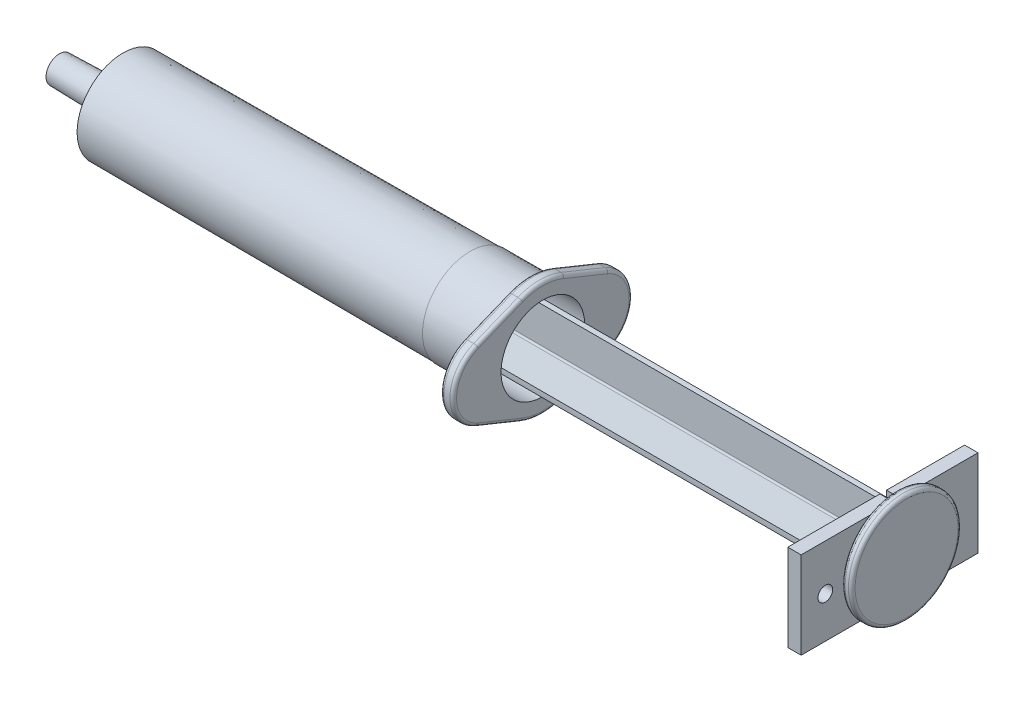
from build123d import *

# Parameters (mm, degrees)
BOSS_EXTRUDE1_DEPTH       = 1.9
FILLET1_R                 = 8.6
FILLET2_R                 = 0.25
FILLET3_R                 = 0.5
FILLET4_R                 = 1
BOSS_EXTRUDE2_START       = 53.880055185
BOSS_EXTRUDE2_2_DEPTH     = 71.319944815
BOSS_EXTRUDE2_START_2     = 123.2
BOSS_EXTRUDE2_3_OUTLINE_R = 1.098363789
BOSS_EXTRUDE2_3_DEPTH     = 2
BOSS_EXTRUDE2_START_3     = 52.05
BOSS_EXTRUDE2_4_DEPTH     = 4.040129852


with BuildPart() as part:
    # Sketch1 → Boss-Extrude1 (new body)
    with BuildSketch(Plane(origin=(72.3, 0, 0), x_dir=(0, 0, -1), z_dir=(1, 0, 0))):
        with BuildLine():
            Line((-9.834595004, -5.292759782), (0, -9.279892888))
            Line((0, -9.279892888), (9.834595004, -5.292759782))
            ThreePointArc((9.834595004, -5.292759782), (13.4, 0), (9.834595004, 5.292759782))
            Line((9.834595004, 5.292759782), (0, 9.279892888))
            Line((0, 9.279892888), (-9.834595004, 5.292759782))
            ThreePointArc((-9.834595004, 5.292759782), (-13.4, 0), (-9.834595004, -5.292759782))
        make_face()
    extrude(amount=-BOSS_EXTRUDE1_DEPTH)

    # Sketch2 → Revolve1 (revolve)
    with BuildSketch(Plane(origin=(0, 0, 0), x_dir=(-1, 0, 0), z_dir=(0, 0, -1)), mode=Mode.PRIVATE) as revolve1_sk:
        Polygon((-70.4, 7.131416054), (-70.4, 0), (0, 0), (0, 2), (-8.5, 2.2), (-9.5, 6.85), (-61.4, 7.031165912), (-61.4, 7.1), align=None)
    revolve(revolve1_sk.sketch.rotate(Axis((70.4, 0, 0), (-1, 0, 0)), 90), axis=Axis((70.4, 0, 0), (-1, 0, 0)))

    # Sketch3 → Hole1 (revolve, cut)
    with BuildSketch(Plane(origin=(72.3, 0, 0), x_dir=(0, 0, -1), z_dir=(0, 1, 0))):
        Polygon((0, 0), (0, 72.3), (1, 72.3), (1, 63.239774349), (6.25, 62.110742091), (6.25, 0), align=None)
    revolve(axis=Axis((78.430023899, 0, 0), (-1, 0, 0)), mode=Mode.SUBTRACT)

    # Fillet1
    fillet1_edges = [part.edges().sort_by_distance(p)[0] for p in [
        (71.35, 9.279892888, 0),
        (71.35, -9.279892888, 0),
    ]]
    fillet(fillet1_edges, radius=FILLET1_R)

    # Fillet2
    fillet2_edges = [part.edges().sort_by_distance(p)[0] for p in [
        (9.060225651, 0, 1),
    ]]
    fillet(fillet2_edges, radius=FILLET2_R)

    # Fillet3
    fillet3_edges = [part.edges().sort_by_distance(p)[0] for p in [
        (70.4, 0, -13.4),
        (70.4, 0, 7.131416054),
        (70.4, 6.631339679, -6.532876496),
        (72.3, -6.631339679, -6.532876496),
        (72.3, 6.631339679, 6.532876496),
        (72.3, 8.6, 0),
        (72.3, -8.6, 0),
        (70.4, -6.631339679, -6.532876496),
        (70.4, 6.631339679, 6.532876496),
        (70.4, 8.6, 0),
        (70.4, -8.6, 0),
        (70.4, 0, 13.4),
        (72.3, 6.631339679, -6.532876496),
        (72.3, 0, -13.4),
        (72.3, -6.631339679, 6.532876496),
        (72.3, 0, 13.4),
        (70.4, -6.631339679, 6.532876496),
    ]]
    fillet(fillet3_edges, radius=FILLET3_R)

    # Fillet4
    fillet4_edges = [part.edges().sort_by_distance(p)[0] for p in [
        (8.5, 0, 2.2),
    ]]
    fillet(fillet4_edges, radius=FILLET4_R)


with BuildPart() as body_2:
    # Boss-Extrude2: read off the stored shape, not the designer's step
    # Boss-Extrude2 outline → Boss-Extrude2 (revolve)
    with BuildSketch(Plane.YX):
        with BuildLine():
            ThreePointArc((7.7, 125.2), (8.053553391, 125.346446609), (8.2, 125.7))
            Line((8.2, 125.7), (8.2, 126.2))
            ThreePointArc((8.2, 126.2), (8.053553391, 126.553553391), (7.7, 126.7))
            Line((7.7, 126.7), (0, 126.7))
            Line((0, 126.7), (0, 125.2))
            Line((0, 125.2), (7.7, 125.2))
        make_face()
        with BuildLine():
            ThreePointArc((5.920861832, 51.089408107), (6.156875164, 51.226512359), (6.25, 51.483081323))
            Line((6.25, 51.483081323), (6.25, 52.05))
            Line((6.25, 52.05), (0, 52.05))
            Line((0, 52.05), (0, 50.45))
            add(Edge.make_bspline(
                [(5.920861832, 51.089408107), (2.983013586, 50.560590548), (0, 50.45)],
                knots=[1.392701781, 1.392701781, 1.392701781, 1.533739867, 1.533739867, 1.533739867], degree=2, weights=[1, 0.997514563, 1]))
        make_face()
    revolve(axis=Axis((0, 0, 0), (1, 0, 0)))

    # Boss-Extrude2 2 outline → Boss-Extrude2 2 (add)
    with BuildSketch(Plane.YZ.offset(BOSS_EXTRUDE2_START)):
        with BuildLine():
            ThreePointArc((-0.738087536, -0.492488713), (-0.565673942, -0.565673942), (-0.492488713, -0.738087536))
            Line((-0.492488713, -0.738087536), (-0.40023184, -6.023480263))
            ThreePointArc((-0.40023184, -6.023480263), (0, -6.036762377), (0.40023184, -6.023480263))
            Line((0.40023184, -6.023480263), (0.492488713, -0.738087536))
            ThreePointArc((0.492488713, -0.738087536), (0.565673942, -0.565673942), (0.738087536, -0.492488713))
            Line((0.738087536, -0.492488713), (6.023480263, -0.40023184))
            ThreePointArc((6.023480263, -0.40023184), (6.036762377, 0), (6.023480263, 0.40023184))
            Line((6.023480263, 0.40023184), (0.738087536, 0.492488713))
            ThreePointArc((0.738087536, 0.492488713), (0.565673942, 0.565673942), (0.492488713, 0.738087536))
            Line((0.492488713, 0.738087536), (0.40023184, 6.023480263))
            ThreePointArc((0.40023184, 6.023480263), (0, 6.036762377), (-0.40023184, 6.023480263))
            Line((-0.40023184, 6.023480263), (-0.492488713, 0.738087536))
            ThreePointArc((-0.492488713, 0.738087536), (-0.565673942, 0.565673942), (-0.738087536, 0.492488713))
            Line((-0.738087536, 0.492488713), (-6.023480263, 0.40023184))
            ThreePointArc((-6.023480263, 0.40023184), (-6.036762377, 0), (-6.023480263, -0.40023184))
            Line((-6.023480263, -0.40023184), (-0.738087536, -0.492488713))
        make_face()
    extrude(amount=BOSS_EXTRUDE2_2_DEPTH)

    # Boss-Extrude2 3 outline → Boss-Extrude2 3 (add)
    with BuildSketch(Plane.YZ.offset(BOSS_EXTRUDE2_START_2)):
        with BuildLine():
            ThreePointArc((-0.492488713, -0.738087536), (-0.565673942, -0.565673942), (-0.738087536, -0.492488713))
            Line((-0.738087536, -0.492488713), (-6.023480263, -0.40023184))
            ThreePointArc((-6.023480263, -0.40023184), (-6.036762377, 0), (-6.023480263, 0.40023184))
            Line((-6.023480263, 0.40023184), (-0.738087536, 0.492488713))
            ThreePointArc((-0.738087536, 0.492488713), (-0.565673942, 0.565673942), (-0.492488713, 0.738087536))
            Line((-0.492488713, 0.738087536), (-0.40023184, 6.023480263))
            ThreePointArc((-0.40023184, 6.023480263), (0, 6.036762377), (0.40023184, 6.023480263))
            Line((0.40023184, 6.023480263), (0.492488713, 0.738087536))
            ThreePointArc((0.492488713, 0.738087536), (0.565673942, 0.565673942), (0.738087536, 0.492488713))
            Line((0.738087536, 0.492488713), (6.832609378, 0.492488713))
            Line((6.832609378, 0.492488713), (6.832609378, 14.269681487))
            Line((6.832609378, 14.269681487), (-6.167972262, 14.269681487))
            Line((-6.167972262, 14.269681487), (-6.167972262, -12.176993067))
            Line((-6.167972262, -12.176993067), (6.832609378, -12.176993067))
            Line((6.832609378, -12.176993067), (6.832609378, -0.492488713))
            Line((6.832609378, -0.492488713), (0.738087536, -0.492488713))
            ThreePointArc((0.738087536, -0.492488713), (0.565673942, -0.565673942), (0.492488713, -0.738087536))
            Line((0.492488713, -0.738087536), (0.40023184, -6.023480263))
            ThreePointArc((0.40023184, -6.023480263), (0, -6.036762377), (-0.40023184, -6.023480263))
            Line((-0.40023184, -6.023480263), (-0.492488713, -0.738087536))
        make_face()
        with Locations((0, 10.65788427)):
            Circle(BOSS_EXTRUDE2_3_OUTLINE_R, mode=Mode.SUBTRACT)
    extrude(amount=BOSS_EXTRUDE2_3_DEPTH)

    # Boss-Extrude2 4 outline → Boss-Extrude2 4 (add)
    with BuildSketch(Plane.YZ.offset(BOSS_EXTRUDE2_START_3)):
        with BuildLine():
            Line((-4.58028551, -0.425422898), (-0.738087536, -0.492488713))
            ThreePointArc((-0.738087536, -0.492488713), (-0.565673942, -0.565673942), (-0.492488713, -0.738087536))
            Line((-0.492488713, -0.738087536), (-0.425422898, -4.58028551))
            ThreePointArc((-0.425422898, -4.58028551), (0, -4.6), (0.425422898, -4.58028551))
            Line((0.425422898, -4.58028551), (0.492488713, -0.738087536))
            ThreePointArc((0.492488713, -0.738087536), (0.565673942, -0.565673942), (0.738087536, -0.492488713))
            Line((0.738087536, -0.492488713), (4.58028551, -0.425422898))
            ThreePointArc((4.58028551, -0.425422898), (4.6, 0), (4.58028551, 0.425422898))
            Line((4.58028551, 0.425422898), (0.738087536, 0.492488713))
            ThreePointArc((0.738087536, 0.492488713), (0.565673942, 0.565673942), (0.492488713, 0.738087536))
            Line((0.492488713, 0.738087536), (0.425422898, 4.58028551))
            ThreePointArc((0.425422898, 4.58028551), (0, 4.6), (-0.425422898, 4.58028551))
            Line((-0.425422898, 4.58028551), (-0.492488713, 0.738087536))
            ThreePointArc((-0.492488713, 0.738087536), (-0.565673942, 0.565673942), (-0.738087536, 0.492488713))
            Line((-0.738087536, 0.492488713), (-4.58028551, 0.425422898))
            ThreePointArc((-4.58028551, 0.425422898), (-4.6, 0), (-4.58028551, -0.425422898))
        make_face()
    extrude(amount=BOSS_EXTRUDE2_4_DEPTH)

    # Boss-Extrude2 5 outline → Boss-Extrude2 5 (revolve, cut)
    with BuildSketch(Plane.YX):
        with BuildLine():
            Line((6.036762378, 53.880055185), (6.036762377, 56.090129852))
            ThreePointArc((6.036762377, 56.090129852), (5.645999412, 54.772109014), (4.6, 53.880055286))
            Line((4.6, 53.880055286), (6.036762378, 53.880055185))
        make_face()
    revolve(axis=Axis((0, 0, 0), (1, 0, 0)), mode=Mode.SUBTRACT)


solid = Compound([part.part, body_2.part])
